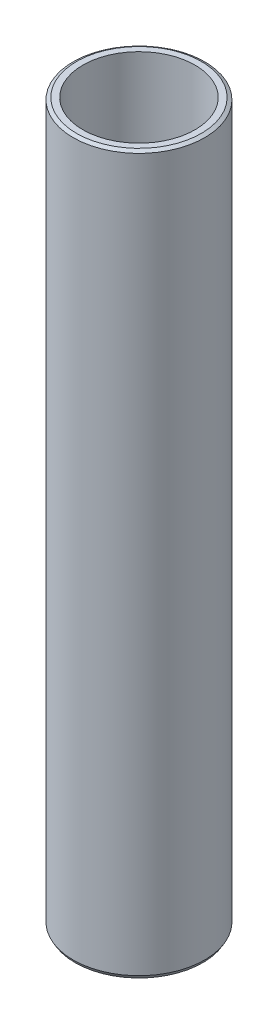
from build123d import *
from OCP.BRepFilletAPI import BRepFilletAPI_MakeChamfer

# Parameters (mm, degrees)
SKETCH1_R           = 55
BOSS_EXTRUDE1_DEPTH = 600
SKETCH2_R           = 46.889095127
CUT_EXTRUDE1_DEPTH  = 606.020660804
CHAMFER1_SIZE       = 1.64484744
CHAMFER1_SIZE2      = 2.848959337


with BuildPart() as part:
    # Sketch1 → Boss-Extrude1 (new body)
    with BuildSketch(Plane(origin=(0, 0, 0), x_dir=(1, 0, 0), z_dir=(0, 1, 0))):
        Circle(SKETCH1_R)
    extrude(amount=BOSS_EXTRUDE1_DEPTH)

    # Sketch2 → Cut-Extrude1 (cut, through all)
    with BuildSketch(Plane(origin=(0, 0, 0), x_dir=(1, 0, 0), z_dir=(0, 1, 0))):
        Circle(SKETCH2_R)
    extrude(amount=CUT_EXTRUDE1_DEPTH, mode=Mode.SUBTRACT)

    # Chamfer1: one chamfer whose edges measure the first distance from different faces: ONE call of the kernel's chamfer builder (chamfer() names one face for all edges)
    chamfer1_edges_1 = [part.edges().sort_by_distance(p)[0] for p in [
        (-55, 600, 0),
    ]]
    chamfer1_side_1 = [part.faces().sort_by_distance(p)[0] for p in [
        (-55, 300, 0),
    ]]
    chamfer1_edges_2 = [part.edges().sort_by_distance(p)[0] for p in [
        (-55, 0, 0),
    ]]
    chamfer1_side_2 = [part.faces().sort_by_distance(p)[0] for p in [
        (-53.444365081, 0, 0),
    ]]
    chamfer1 = BRepFilletAPI_MakeChamfer(part.part.solid().wrapped)
    for e in chamfer1_edges_1:
        chamfer1.Add(CHAMFER1_SIZE, CHAMFER1_SIZE2, e.wrapped, chamfer1_side_1[0].wrapped)  # the first distance lies on this face
    for e in chamfer1_edges_2:
        chamfer1.Add(CHAMFER1_SIZE, CHAMFER1_SIZE2, e.wrapped, chamfer1_side_2[0].wrapped)  # the first distance lies on this face
    add(Compound.cast(chamfer1.Shape()), mode=Mode.REPLACE)


solid = part.part
